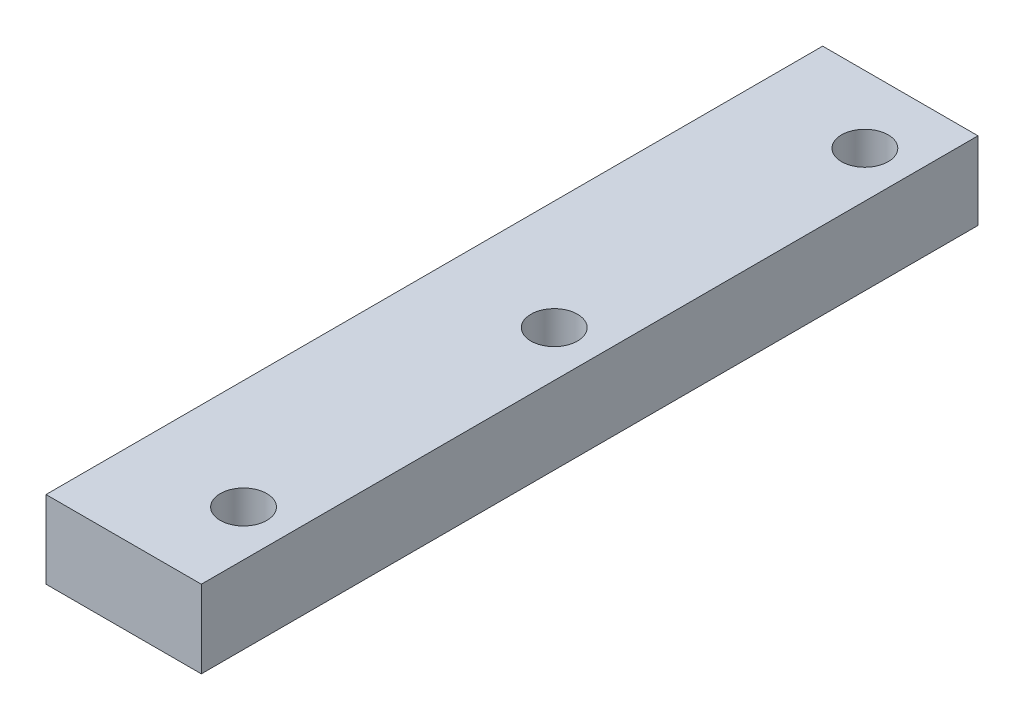
from build123d import *

# Parameters (mm, degrees)
SKETCH1_W           = 20
SKETCH1_H           = 10
BOSS_EXTRUDE1_DEPTH = 100
SKETCH2_R           = 3
CUT_EXTRUDE1_DEPTH  = 140
LPATTERN1_COUNT     = 4
LPATTERN1_PITCH     = 40


with BuildPart() as part:
    # Sketch1 → Boss-Extrude1 (new body)
    with BuildSketch(Plane.XY):
        with Locations((10, 15.187969925)):
            Rectangle(SKETCH1_W, SKETCH1_H)
    extrude(amount=BOSS_EXTRUDE1_DEPTH)

    # Sketch2 → Cut-Extrude1 (cut)
    with BuildSketch(Plane(origin=(0, 20.187969925, 0), x_dir=(1, 0, 0), z_dir=(0, 1, 0))):
        with Locations((14.108562183, -8.673667423)):
            Circle(SKETCH2_R)
    cut_extrude1 = extrude(amount=-CUT_EXTRUDE1_DEPTH, mode=Mode.SUBTRACT)

    # LPattern1: Cut-Extrude1 ×4
    with Locations(*[(0, 0, i * LPATTERN1_PITCH) for i in range(1, LPATTERN1_COUNT)]):
        add(cut_extrude1, mode=Mode.SUBTRACT)


solid = part.part
